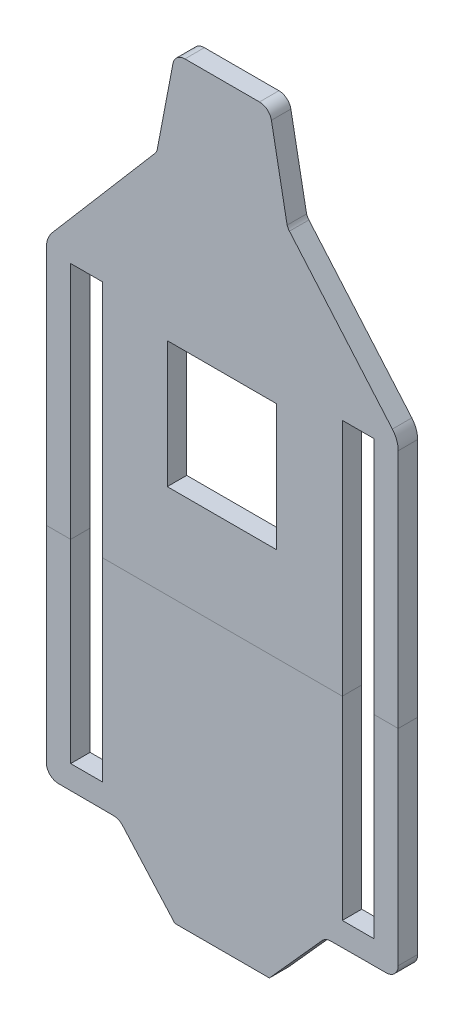
from build123d import *

# Parameters (mm, degrees)
SKETCH1_W              = 13
SKETCH1_H              = 178.133466815
BOSS_EXTRUDE1_DEPTH    = 8
SKETCH2_W              = 45
SKETCH2_H              = 52
CUT_EXTRUDE1_DEPTH     = 342.206659287
SPLIT1_SURFACE_1_BACK  = 343.199
SPLIT1_SURFACE_1_DEPTH = 686.398
SPLIT1_SURFACE_2_BACK  = 343.199
SPLIT1_SURFACE_2_DEPTH = 686.398


with BuildPart() as part:
    # Sketch1 → Boss-Extrude1 (new body)
    with BuildSketch(Plane.XY):
        with BuildLine():
            Line((70, 309.985818768), (85.299227191, 309.985818768))
            ThreePointArc((85.299227191, 309.985818768), (88.489017574, 308.836174247), (90.211957942, 305.915913694))
            Line((90.211957942, 305.915913694), (96.672728921, 271.790334282))
            ThreePointArc((96.672728921, 271.790334282), (97.06575438, 270.906904614), (97.621470019, 270.115641625))
            Line((97.621470019, 270.115641625), (139.950460317, 220.786053348))
            ThreePointArc((139.950460317, 220.786053348), (141.739336996, 217.746026552), (142.361429131, 214.274017901))
            Line((142.361429131, 214.274017901), (142.361429131, 30.859943174))
            ThreePointArc((142.361429131, 30.859943174), (140.896963037, 27.324409268), (137.361429131, 25.859943174))
            Line((137.361429131, 25.859943174), (114.717190871, 25.782318449))
            ThreePointArc((114.717190871, 25.782318449), (112.681998989, 25.341726514), (111.002773989, 24.110332733))
            Line((111.002773989, 24.110332733), (89.38285929, 0))
            Line((89.38285929, 0), (50.5, 0))
            Line((50.5, 0), (28.997226011, 24.110332733))
            ThreePointArc((28.997226011, 24.110332733), (27.318001011, 25.341726514), (25.282809129, 25.782318449))
            Line((25.282809129, 25.782318449), (2.638570869, 25.859943174))
            ThreePointArc((2.638570869, 25.859943174), (-0.896963037, 27.324409268), (-2.361429131, 30.859943174))
            Line((-2.361429131, 30.859943174), (-2.361429131, 214.274017901))
            ThreePointArc((-2.361429131, 214.274017901), (-1.739336996, 217.746026552), (0.049539683, 220.786053348))
            Line((0.049539683, 220.786053348), (42.261389271, 270.115641625))
            ThreePointArc((42.261389271, 270.115641625), (42.81710491, 270.906904614), (43.210130369, 271.790334282))
            Line((43.210130369, 271.790334282), (49.724618218, 305.923183314))
            ThreePointArc((49.724618218, 305.923183314), (51.449026762, 308.838533573), (54.635967087, 309.985818768))
            Line((54.635967087, 309.985818768), (70, 309.985818768))
        make_face()
        with Locations((14.138570869, 124.559226069)):
            Rectangle(SKETCH1_W, SKETCH1_H, mode=Mode.SUBTRACT)
        with Locations((125.861429131, 124.559226069)):
            Rectangle(SKETCH1_W, SKETCH1_H, mode=Mode.SUBTRACT)
    extrude(amount=BOSS_EXTRUDE1_DEPTH)

    # Sketch2 → Cut-Extrude1 (cut, through all)
    with BuildSketch(Plane.XY.offset(8)):
        with Locations((69.88285929, 180.008918923)):
            Rectangle(SKETCH2_W, SKETCH2_H)
    extrude(amount=-CUT_EXTRUDE1_DEPTH, mode=Mode.SUBTRACT)


with BuildPart() as body_2:
    # Split1: the piece behind the surface
    add(part.part)
    # Split1 surface: a surface, the sketch's curves swept straight by 686.398 mm
    with BuildLine(Plane(origin=(0, 0, 0), x_dir=(-1, 0, 0), z_dir=(0, 0, -1)).offset(-SPLIT1_SURFACE_1_BACK), mode=Mode.PRIVATE) as split1_surface_1_path:
        Line((-142.361429131, 115.359943174), (2.361429131, 115.359943174))
    split1_surface_1 = Shell.extrude(split1_surface_1_path.wire(), (0 * SPLIT1_SURFACE_1_DEPTH, 0 * SPLIT1_SURFACE_1_DEPTH, -1 * SPLIT1_SURFACE_1_DEPTH))
    split(bisect_by=split1_surface_1, keep=Keep.BOTTOM)


with BuildPart() as part_1:
    add(part.part)

    # Split1: split by a surface, the side it looks to stays
    # Split1 surface: a surface, the sketch's curves swept straight by 686.398 mm
    with BuildLine(Plane(origin=(0, 0, 0), x_dir=(-1, 0, 0), z_dir=(0, 0, -1)).offset(-SPLIT1_SURFACE_2_BACK), mode=Mode.PRIVATE) as split1_surface_2_path:
        Line((-142.361429131, 115.359943174), (2.361429131, 115.359943174))
    split1_surface_2 = Shell.extrude(split1_surface_2_path.wire(), (0 * SPLIT1_SURFACE_2_DEPTH, 0 * SPLIT1_SURFACE_2_DEPTH, -1 * SPLIT1_SURFACE_2_DEPTH))
    split(bisect_by=split1_surface_2, keep=Keep.TOP)


solid = Compound([body_2.part, part_1.part])
